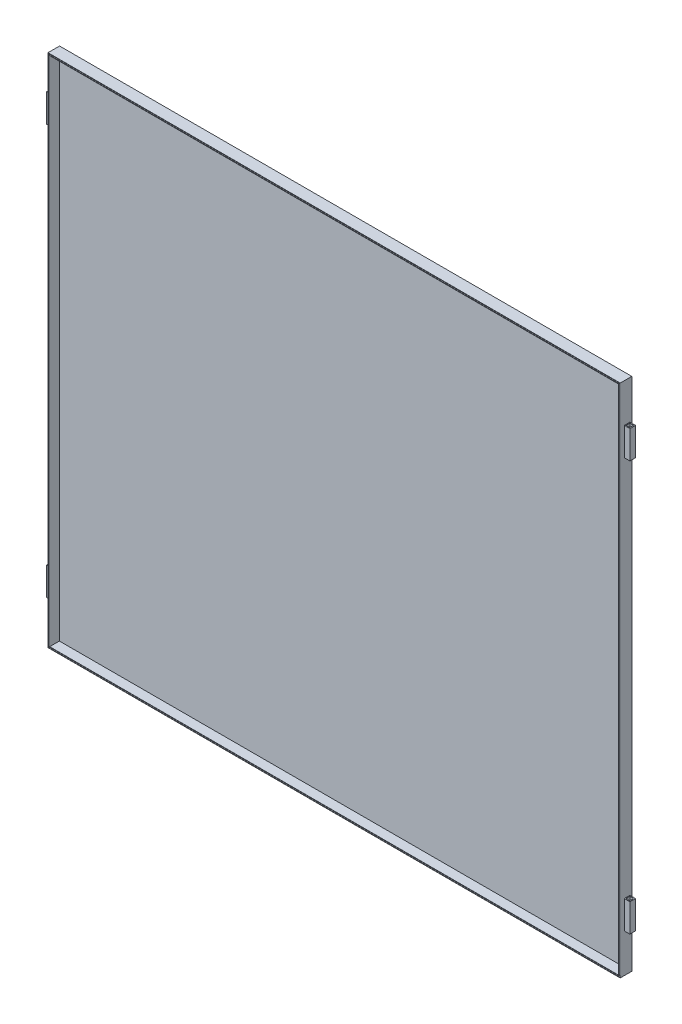
from build123d import *

# Parameters (mm, degrees)
SKETCH1_W           = 3058
SKETCH1_H           = 2753.2
SKETCH1_W_2         = 3048
SKETCH1_H_2         = 2743.2
BOSS_EXTRUDE1_DEPTH = 50
SHELL4_T            = 2
SKETCH2_W           = 30
SKETCH2_H           = 150
BOSS_EXTRUDE2_DEPTH = 30
SKETCH4_W           = 20
SKETCH4_H           = 20
CUT_EXTRUDE1_DEPTH  = 100
SKETCH5_W           = 20
SKETCH5_H           = 20
CUT_EXTRUDE2_DEPTH  = 100
MIRROR2_START       = -2
MIRROR2_DEPTH       = 30
MIRROR2_2_OUTLINE_W = 20
MIRROR2_2_OUTLINE_H = 100
MIRROR2_2_DEPTH     = 5
MIRROR2_START_2     = 23
MIRROR2_3_OUTLINE_W = 20
MIRROR2_3_OUTLINE_H = 100
MIRROR2_3_DEPTH     = 5
SKETCH7_W           = 3062
SKETCH7_H           = 2757.2
BOSS_EXTRUDE3_DEPTH = 10
SKETCH8_R           = 5
CUT_EXTRUDE3_DEPTH  = 2600


# Read off the part's stored shape, not the designer's step: Mirror2
with BuildPart() as part:
    # Sketch1 → Boss-Extrude1 (new body)
    with BuildSketch(Plane.XY):
        Rectangle(SKETCH1_W, SKETCH1_H)
        Rectangle(SKETCH1_W_2, SKETCH1_H_2, mode=Mode.SUBTRACT)
    extrude(amount=BOSS_EXTRUDE1_DEPTH)

    # Shell4
    shell4_openings = [part.faces().sort_by_distance(p)[0] for p in [
        (-1524.885212735, 0, 50),
    ]]
    offset(amount=SHELL4_T, openings=shell4_openings, kind=Kind.INTERSECTION)

    # Sketch2 → Boss-Extrude2 (add)
    with BuildSketch(Plane.ZY.offset(1531)):
        with Locations((13, 1096.4)):
            Rectangle(SKETCH2_W, SKETCH2_H)
    boss_extrude2 = extrude(amount=BOSS_EXTRUDE2_DEPTH)

    # Mirror1: Boss-Extrude2 across plane
    add(boss_extrude2.mirror(Plane.ZX))

    # Sketch4 → Cut-Extrude1 (cut)
    with BuildSketch(Plane(origin=(0, 1171.4, 0), x_dir=(1, 0, 0), z_dir=(0, 1, 0))):
        with Locations((-1545.537717339, -13)):
            Rectangle(SKETCH4_W, SKETCH4_H)
    extrude(amount=-CUT_EXTRUDE1_DEPTH, mode=Mode.SUBTRACT)

    # Sketch5 → Cut-Extrude2 (cut)
    with BuildSketch(Plane(origin=(0, -1021.4, 0), x_dir=(1, 0, 0), z_dir=(0, 1, 0))):
        with Locations((-1545.537717339, -13)):
            Rectangle(SKETCH5_W, SKETCH5_H)
    extrude(amount=-CUT_EXTRUDE2_DEPTH, mode=Mode.SUBTRACT)

    # Mirror2 outline → Mirror2 (add)
    with BuildSketch(Plane.XY.offset(MIRROR2_START)):
        Polygon((1531, 1171.4), (1531, 1021.4), (1561, 1021.4), (1561, 1171.4), (1555.537717339, 1171.4), (1555.537717339, 1071.4), (1535.537717339, 1071.4), (1535.537717339, 1171.4), align=None)
        Polygon((1535.537717339, -1021.4), (1531, -1021.4), (1531, -1171.4), (1561, -1171.4), (1561, -1021.4), (1555.537717339, -1021.4), (1555.537717339, -1121.4), (1535.537717339, -1121.4), align=None)
    extrude(amount=MIRROR2_DEPTH)

    # Mirror2 2 outline → Mirror2 2 (add)
    with BuildSketch(Plane.XY.offset(MIRROR2_START)):
        with Locations((1545.537717339, -1071.4)):
            Rectangle(MIRROR2_2_OUTLINE_W, MIRROR2_2_OUTLINE_H)
        with Locations((1545.537717339, 1121.4)):
            Rectangle(MIRROR2_2_OUTLINE_W, MIRROR2_2_OUTLINE_H)
    extrude(amount=MIRROR2_2_DEPTH)

    # Mirror2 3 outline → Mirror2 3 (add)
    with BuildSketch(Plane.XY.offset(MIRROR2_START_2)):
        with Locations((1545.537717339, -1071.4)):
            Rectangle(MIRROR2_3_OUTLINE_W, MIRROR2_3_OUTLINE_H)
        with Locations((1545.537717339, 1121.4)):
            Rectangle(MIRROR2_3_OUTLINE_W, MIRROR2_3_OUTLINE_H)
    extrude(amount=MIRROR2_3_DEPTH)

    # Sketch7 → Boss-Extrude3 (add)
    with BuildSketch(Plane(origin=(0, 0, -2), x_dir=(-1, 0, 0), z_dir=(0, 0, -1))):
        Rectangle(SKETCH7_W, SKETCH7_H)
    extrude(amount=BOSS_EXTRUDE3_DEPTH)

    # Sketch8 → Cut-Extrude3 (cut)
    with BuildSketch(Plane(origin=(0, 1071.4, 0), x_dir=(1, 0, 0), z_dir=(0, 1, 0))):
        with Locations(Location((-1545.537717339, -13, 0), (0, 0, 270))):
            Circle(SKETCH8_R)
    cut_extrude3 = extrude(amount=-CUT_EXTRUDE3_DEPTH, mode=Mode.SUBTRACT)

    # Mirror3: Cut-Extrude3 across plane
    add(cut_extrude3.mirror(Plane(origin=(0, 0, 0), x_dir=(0, 0, 1), z_dir=(1, 0, 0))), mode=Mode.SUBTRACT)


solid = part.part
